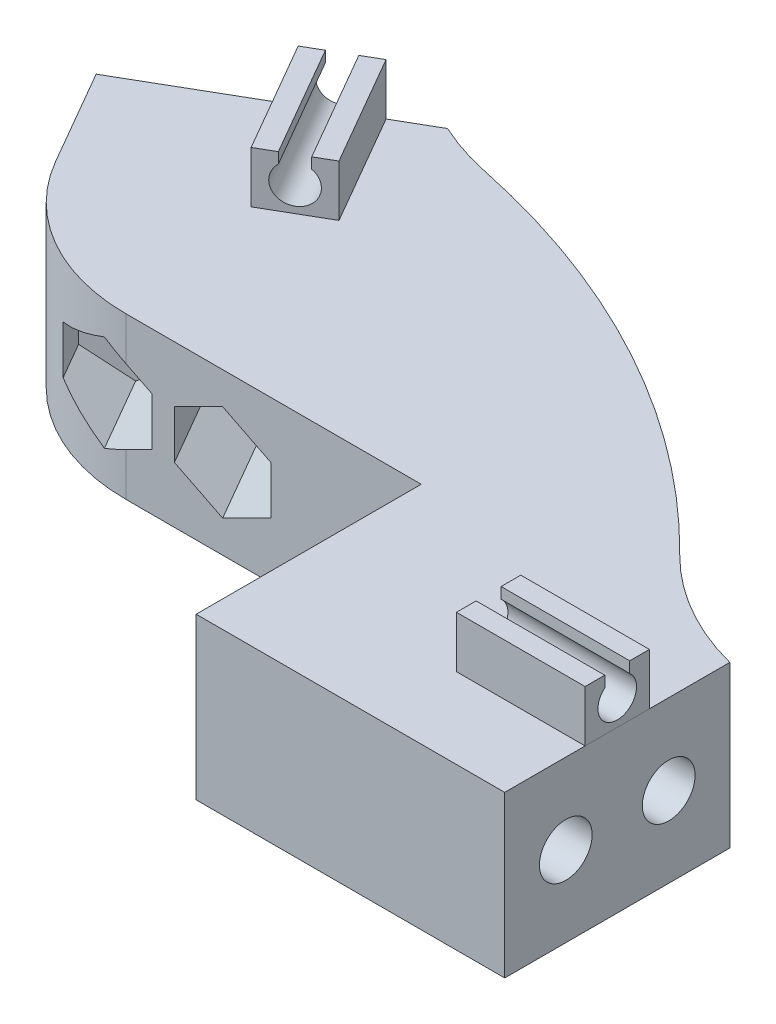
from build123d import *

# Parameters (mm, degrees)
BOSS_EXTRUDE1_DEPTH = 25
SKETCH2_R           = 4.1
CUT_EXTRUDE1_DEPTH  = 153.571488895
SKETCH3_R           = 4.1
CUT_EXTRUDE2_DEPTH  = 135.704378021
CUT_EXTRUDE4_START  = -28
CUT_EXTRUDE4_DEPTH  = 107.704378021
CHAMFER1_SIZE       = 56
CUT_EXTRUDE5_DEPTH  = 107.147290362
BOSS_EXTRUDE2_DEPTH = 20
BOSS_EXTRUDE3_DEPTH = 20
SKETCH9_W           = 20
SKETCH9_H           = 35
CUT_EXTRUDE6_DEPTH  = 107.147290362
BOSS_EXTRUDE4_DEPTH = 25
FILLET1_R           = 40
FILLET2_R           = 30


with BuildPart() as part:
    # Sketch1 → Boss-Extrude1 (new body)
    with BuildSketch(Plane(origin=(0, 0, 0), x_dir=(1, 0, 0), z_dir=(0, 1, 0))):
        Polygon((-61.424858117, 58.394853086), (-23.924858117, -6.557052198), (67.055903996, -6.557052198), (67.055903996, 28.442947802), (2.055903996, 28.442947802), (-26.783841966, 78.394853086), align=None)
    extrude(amount=BOSS_EXTRUDE1_DEPTH)

    # Sketch2 → Cut-Extrude1 (cut, through all)
    with BuildSketch(Plane(origin=(67.055903996, 0, 0), x_dir=(0, 0, -1), z_dir=(1, 0, 0))):
        with Locations((2.942947802, 12.5)):
            Circle(SKETCH2_R)
        with Locations((18.942947802, 12.5)):
            Circle(SKETCH2_R)
    extrude(amount=-CUT_EXTRUDE1_DEPTH, mode=Mode.SUBTRACT)

    # Sketch3 → Cut-Extrude2 (cut, through all)
    with BuildSketch(Plane(origin=(-40.641927641, 0, -70.393883591), x_dir=(-0.8660254037844396, 0, 0.4999999999999984), z_dir=(-0.49999999999999833, 0, -0.8660254037844395))):
        with Locations((-4.00193899, 12.5)):
            Circle(SKETCH3_R)
        with Locations((11.99806101, 12.5)):
            Circle(SKETCH3_R)
    extrude(amount=-CUT_EXTRUDE2_DEPTH, mode=Mode.SUBTRACT)

    # Sketch5 → Cut-Extrude4 (cut, through all)
    with BuildSketch(Plane(origin=(-40.641927641, 0, -70.393883591), x_dir=(-0.8660254037844397, 0, 0.4999999999999983), z_dir=(-0.4999999999999982, 0, -0.8660254037844396)).offset(CUT_EXTRUDE4_START)):
        Polygon((-10.497129518, 16.25), (-10.497129518, 8.75), (-4.00193899, 5), (2.493251539, 8.75), (2.493251539, 16.25), (-4.00193899, 20), align=None)
        Polygon((5.502870482, 8.75), (11.99806101, 5), (18.493251539, 8.75), (18.493251539, 16.25), (11.99806101, 20), (5.502870482, 16.25), align=None)
    extrude(amount=-CUT_EXTRUDE4_DEPTH, mode=Mode.SUBTRACT)

    # Chamfer1
    chamfer1_edges = [part.edges().sort_by_distance(p)[0] for p in [
        (2.055903996, 12.5, -28.442947802),
    ]]
    chamfer(chamfer1_edges, length=CHAMFER1_SIZE)

    # Sketch6 → Cut-Extrude5 (cut, through all)
    with BuildSketch(Plane.XZ):
        Polygon((-0.924858117, 6.557052198), (-0.924858117, -28.442947802), (-44.132117539, -28.442947802), (-23.924858117, 6.557052198), align=None)
    extrude(amount=-CUT_EXTRUDE5_DEPTH, mode=Mode.SUBTRACT)

    # Sketch7 → Boss-Extrude2 (add)
    with BuildSketch(Plane(origin=(-40.641927641, 0, -70.393883591), x_dir=(-0.86602540378444, 0, 0.49999999999999784), z_dir=(-0.49999999999999784, 0, -0.86602540378444))):
        with BuildLine():
            Line((0.99806101, 33), (0.99806101, 25))
            Line((0.99806101, 25), (-9.00193899, 25))
            Line((-9.00193899, 25), (-9.00193899, 33))
            Line((-9.00193899, 33), (-5.90193899, 33))
            Line((-5.90193899, 33), (-5.90193899, 31.321637353))
            ThreePointArc((-5.90193899, 31.321637353), (-4.00193899, 26), (-2.10193899, 31.321637353))
            Line((-2.10193899, 31.321637353), (-2.10193899, 33))
            Line((-2.10193899, 33), (0.99806101, 33))
        make_face()
    extrude(amount=-BOSS_EXTRUDE2_DEPTH)

    # Sketch9 → Cut-Extrude6 (cut, through all)
    with BuildSketch(Plane(origin=(0, 25, 0), x_dir=(1, 0, 0), z_dir=(0, 1, 0))):
        with Locations((9.075141883, 10.942947802)):
            Rectangle(SKETCH9_W, SKETCH9_H)
    extrude(amount=-CUT_EXTRUDE6_DEPTH, mode=Mode.SUBTRACT)

    # Sketch10 → Boss-Extrude4 (add)
    with BuildSketch(Plane(origin=(0, 25, 0), x_dir=(1, 0, 0), z_dir=(0, 1, 0))):
        with BuildLine():
            Line((58.055903996, 28.442947802), (-25.944096004, 76.940370414))
            ThreePointArc((-25.944096004, 76.940370414), (20.671866984, 60.686741527), (58.055903996, 28.442947802))
        make_face()
    extrude(amount=-BOSS_EXTRUDE4_DEPTH)

    # Fillet1
    # the kernel refuses this fillet: 40 mm, written as the material it adds along each edge
    with BuildSketch(Plane(origin=(-25.944096004, 0, -76.940370414), x_dir=(-0.4999999999999963, 0, -0.8660254037844409), z_dir=(0, 1, 0))) as fillet1_piece_1:
        with BuildLine():
            CenterArc((24.734711677, -32.687258101), FILLET1_R, 125.196366451, 12.952121212)
            Line((-5.060346158, -5.999160967), (-5.656247315, -5.465399025))
            ThreePointArc((-5.656247315, -5.465399025), (-3.097082225, -2.521387527), (-0.626569921, 0.497403391))
            Line((-0.626569921, 0.497403391), (0, 0.8))
            ThreePointArc((0, 0.8), (0.839745962, 0.8), (1.218387529, 0.653745162))
            Line((1.218387529, 0.653745162), (1.679491924, 0))
        make_face()
    extrude(amount=25)
    with BuildSketch(Plane(origin=(58.055903996, 0, -28.442947802), x_dir=(1, 0, 0), z_dir=(0, 1, 0))) as fillet1_piece_2:
        with BuildLine():
            CenterArc((19.072279139, 38.711099093), FILLET1_R, 224.605770428, 30.809763912)
            Line((-9.40593392, 10.622108705), (-9.975498181, 10.060328897))
            ThreePointArc((-9.975498181, 10.060328897), (-5.159081438, 4.907162549), (-0.626569921, -0.497403391))
            Line((-0.626569921, -0.497403391), (0, -0.8))
            ThreePointArc((0, -0.8), (4.5, -0.8), (8.798554417, -0.774221982))
            Line((8.798554417, -0.774221982), (9, 0))
        make_face()
    extrude(amount=25)

    # Fillet2
    # the kernel refuses this fillet: 30 mm, written as the material it takes off along each edge
    with BuildSketch(Plane(origin=(-44.132117539, -43.301270189, -28.442947802), x_dir=(-0.4999999999999983, 0, -0.8660254037844396), z_dir=(0, 1, 0))) as fillet2_piece_1:
        with BuildLine():
            CenterArc((FILLET2_R * 0.57735026919, -FILLET2_R), FILLET2_R, 90, 60)
            Line((-FILLET2_R * 0.288675134595, -FILLET2_R * 0.5), (0, 0))
            Line((0, 0), (FILLET2_R * 0.57735026919, 0))
        make_face()
    extrude(amount=111.602540378, mode=Mode.SUBTRACT)


with BuildPart() as body_2:
    # Sketch8 → Boss-Extrude3 (new body)
    with BuildSketch(Plane(origin=(67.055903996, 0, 0), x_dir=(0, 0, -1), z_dir=(1, 0, 0))):
        with BuildLine():
            Line((5.942947802, 33), (9.002583557, 33))
            Line((9.002583557, 33), (9.002583557, 31.288009309))
            ThreePointArc((9.002583557, 31.288009309), (10.942947802, 26), (12.883312047, 31.288009309))
            Line((12.883312047, 31.288009309), (12.883312047, 33))
            Line((12.883312047, 33), (15.942947802, 33))
            Line((15.942947802, 33), (15.942947802, 25))
            Line((15.942947802, 25), (5.942947802, 25))
            Line((5.942947802, 25), (5.942947802, 33))
        make_face()
    extrude(amount=-BOSS_EXTRUDE3_DEPTH)


solid = Compound([part.part, body_2.part])
